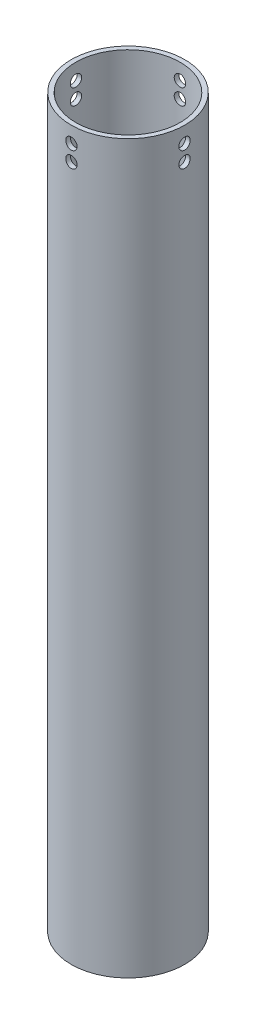
from build123d import *

# Parameters (mm, degrees)
SKETCH_1_R               = 25
SKETCH_1_R_2             = 23
EXTRUDE_1_DEPTH          = 320
SKETCH_2_R               = 2.5
CUT_EXTRUDE_1_DEPTH      = 322.94720064
PATTERN_CIRCULAR_1_COUNT = 4


with BuildPart() as part:
    # Эскиз1 → Бобышка-Вытянуть1 (new body)
    with BuildSketch(Plane(origin=(0, 0, 0), x_dir=(1, 0, 0), z_dir=(0, 1, 0))):
        Circle(SKETCH_1_R)
        Circle(SKETCH_1_R_2, mode=Mode.SUBTRACT)
    extrude(amount=EXTRUDE_1_DEPTH)

    # Эскиз2 → Вырез-Вытянуть1 (cut, through all)
    with BuildSketch(Plane(origin=(0, 0, 0), x_dir=(0, 0, -1), z_dir=(1, 0, 0))):
        with Locations((0, 313)):
            Circle(SKETCH_2_R)
        with Locations((0, 306)):
            Circle(SKETCH_2_R)
    cut_extrude_1 = extrude(amount=-CUT_EXTRUDE_1_DEPTH, mode=Mode.SUBTRACT)

    # Круговой массив1: Вырез-Вытянуть1 ×4 about axis
    pattern_circular_1_axis = Axis((0, 320, 0), (0, -1, 0))
    for i in range(1, PATTERN_CIRCULAR_1_COUNT):
        add(cut_extrude_1.rotate(pattern_circular_1_axis, i * 360 / PATTERN_CIRCULAR_1_COUNT), mode=Mode.SUBTRACT)


solid = part.part
